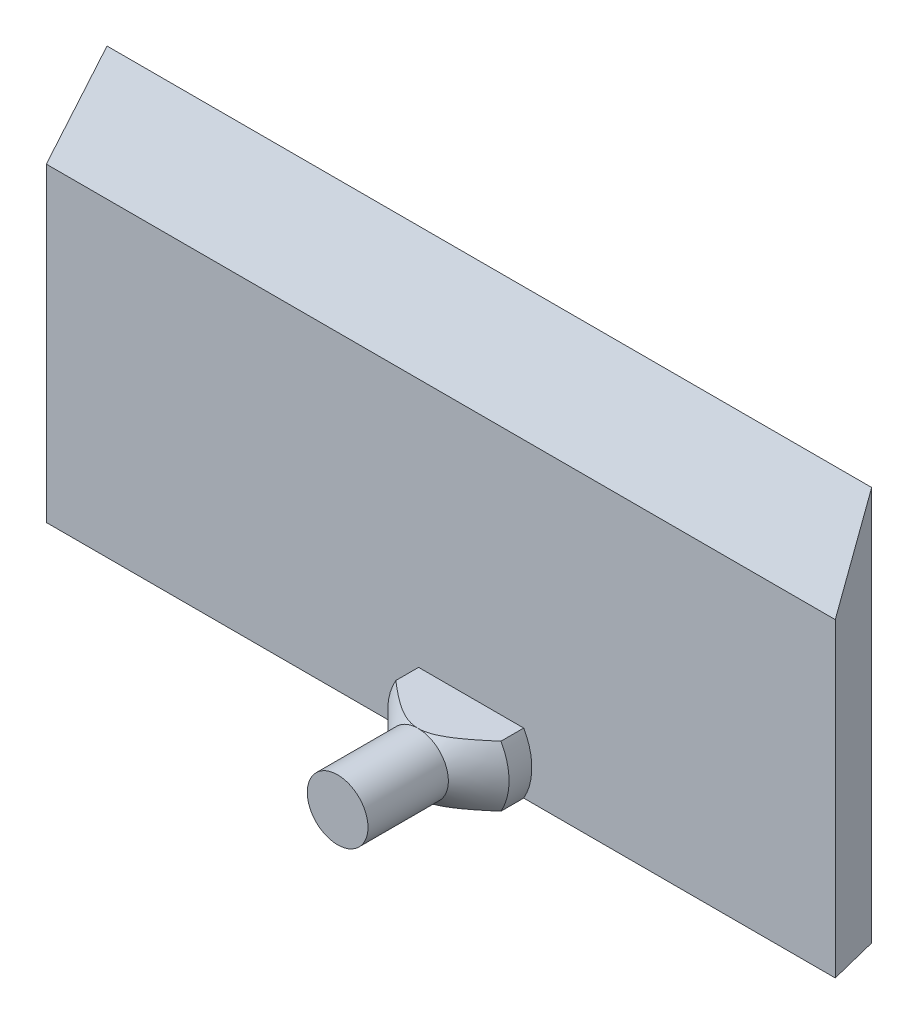
from build123d import *

# Parameters (mm, degrees)
AUFSATZ_LINEAR_AUSTRAGEN1_DEPTH = 1.6
SKIZZE1_3_R                     = 1.0000000000000002
AUFSATZ_LINEAR_AUSTRAGEN2_DEPTH = 6
AUFSATZ_LINEAR_AUSTRAGEN3_DEPTH = 3.35
FASE1_SIZE                      = 1
FASE2_SIZE                      = 1.6
FASE2_SIZE_2                    = 0.4
FASE3_SIZE                      = 0.4
FASE3_SIZE_2                    = 1.6
FASE4_SIZE                      = 2.771281292
FASE4_SIZE_2                    = 1.6


# Some blends are built 0.0001 mm under size
with BuildPart() as part:
    # Skizze1 → Aufsatz-Linear austragen1 (new body)
    with BuildSketch(Plane.XY):
        Polygon((-13, 6.500000000000001), (13, 6.500000000000001), (13.000000000000004, -6.499999999999999), (-12.999999999999998, -6.499999999999999), align=None)
    extrude(amount=AUFSATZ_LINEAR_AUSTRAGEN1_DEPTH)

    # Skizze1<3> → Aufsatz-Linear austragen2 (add)
    with BuildSketch(Plane.XY):
        with Locations(Location((1.0000000000000009, -5.499999999999999, 0), (0, 0, 270))):
            Circle(SKIZZE1_3_R)
    extrude(amount=AUFSATZ_LINEAR_AUSTRAGEN2_DEPTH)

    # Skizze1<4> → Aufsatz-Linear austragen3 (add)
    with BuildSketch(Plane.XY):
        with BuildLine():
            ThreePointArc((-0.732050807568877, -4.499999999999999), (-0.9999999999999996, -5.4999999999999885), (-0.7320508075688883, -6.49999999999998))
            Line((-0.7320508075688945, -6.499999999999999), (1.000000000000023, -6.499999999999999))
            ThreePointArc((1.0000000000000238, -6.499999999999999), (6.7e-16, -5.499999999999999), (1.000000000000023, -4.499999999999999))
            Line((1.000000000000023, -4.499999999999999), (-0.732050807568877, -4.499999999999999))
        make_face()
        with BuildLine():
            Line((1.000000000000023, -6.499999999999999), (2.7320508075688927, -6.499999999999999))
            ThreePointArc((2.732050807568887, -6.499999999999985), (2.93185165257814, -6.0176380902050335), (3.0000000000000013, -5.5))
            ThreePointArc((3.0000000000000013, -5.499999999999999), (2.931851652578138, -4.982361909794958), (2.7320508075688785, -4.499999999999999))
            Line((2.7320508075688785, -4.499999999999999), (1.000000000000023, -4.499999999999999))
            ThreePointArc((1.000000000000023, -4.499999999999999), (1.7071067811865563, -4.792893218813459), (2.000000000000001, -5.499999999999999))
            ThreePointArc((2.000000000000001, -5.499999999999999), (1.7071067811865566, -6.207106781186539), (1.0000000000000238, -6.499999999999999))
        make_face()
    extrude(amount=AUFSATZ_LINEAR_AUSTRAGEN3_DEPTH)

    # Fase1
    fase1_edges = [part.edges().sort_by_distance(p)[0] for p in [
        (3.0000000000000018, -5.499999999999993, 3.35),
        (-1, -5.499999999999988, 3.35),
    ]]
    chamfer(fase1_edges, length=FASE1_SIZE - 0.0001)  # a hair under: the kernel refuses the full size

    # Fase2
    # the kernel refuses this chamfer: 1.6, 0.4 mm, written as the material it takes off along each edge
    with BuildSketch(Plane(origin=(12.999999999999998, 10.655403999635418, 0), x_dir=(0.009338610640317949, 0, 0.9999563942249226), z_dir=(2.7e-16, -1, 0))) as fase2_piece_1:
        Polygon((FASE2_SIZE * 0.999956394225, FASE2_SIZE * 0.00933861064032), (-FASE2_SIZE_2 * 0.00933861064032, FASE2_SIZE_2 * 0.999956394225), (0, 0), align=None)
    extrude(amount=21.310807999270835, mode=Mode.SUBTRACT)

    # Fase3
    # the kernel refuses this chamfer: 1.6, 0.4 mm, written as the material it takes off along each edge
    with BuildSketch(Plane(origin=(-12.999999999999998, -10.655403999635418, 0), x_dir=(0.9890197255468893, 0, -0.1477835663365709), z_dir=(-1.4e-16, 1, 0))) as fase3_piece_1:
        Polygon((FASE3_SIZE * 0.989019725547, -FASE3_SIZE * 0.147783566337), (-FASE3_SIZE_2 * 0.147783566337, -FASE3_SIZE_2 * 0.989019725547), (0, 0), align=None)
    extrude(amount=21.310807999270835, mode=Mode.SUBTRACT)

    # Fase4
    # the kernel refuses this chamfer: 2.771281292, 1.6 mm, written as the material it takes off along each edge
    with BuildSketch(Plane(origin=(-20.169542352935284, 6.500000000000001, 1.6), x_dir=(0, -0.999813220622208, 0.01932676561270061), z_dir=(1, 0, 0))) as fase4_piece_1:
        Polygon((FASE4_SIZE * 0.999813220662, FASE4_SIZE * 0.0193267656135), (-FASE4_SIZE_2 * 0.0193267656127, FASE4_SIZE_2 * 0.999813220622), (0, 0), align=None)
    extrude(amount=40.33908470587056, mode=Mode.SUBTRACT)


solid = part.part
